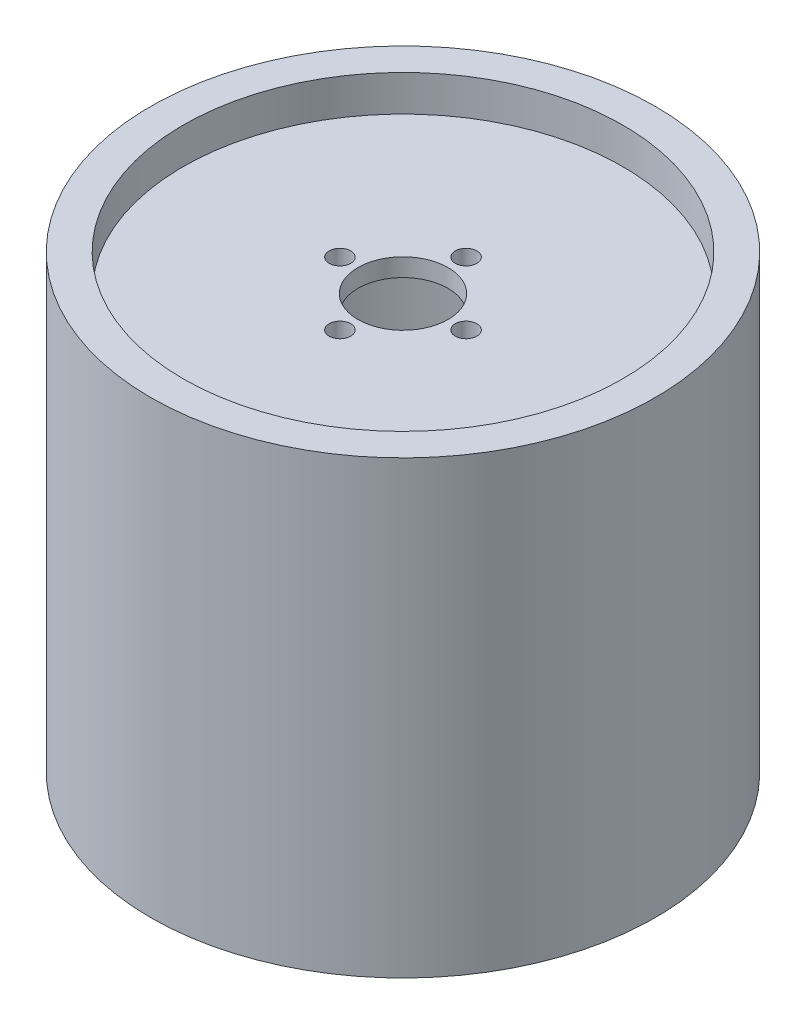
from build123d import *

# Parameters (mm, degrees)
SKETCH_1_R          = 70
EXTRUDE_1_DEPTH     = 125
SKETCH_4_R          = 60
CUT_EXTRUDE_4_DEPTH = 110
SKETCH_5_R          = 61
CUT_EXTRUDE_5_DEPTH = 10
SKETCH_6_R          = 12.5
SKETCH_6_R_2        = 3
CUT_EXTRUDE_6_DEPTH = 152.739909055
SKETCH_7_R          = 60
SKETCH_7_R_2        = 50
EXTRUDE_2_DEPTH     = 5
SKETCH_8_R          = 2.5
CUT_EXTRUDE_7_DEPTH = 5


with BuildPart() as part:
    # 스케치1 → 보스-돌출1 (new body)
    with BuildSketch(Plane(origin=(0, 0, 0), x_dir=(1, 0, 0), z_dir=(0, 1, 0))):
        Circle(SKETCH_1_R)
    extrude(amount=EXTRUDE_1_DEPTH)

    # 스케치4 → 컷-돌출4 (cut)
    with BuildSketch(Plane.XZ):
        Circle(SKETCH_4_R)
    extrude(amount=-CUT_EXTRUDE_4_DEPTH, mode=Mode.SUBTRACT)

    # 스케치5 → 컷-돌출5 (cut)
    with BuildSketch(Plane(origin=(0, 125, 0), x_dir=(1, 0, 0), z_dir=(0, 1, 0))):
        Circle(SKETCH_5_R)
    extrude(amount=-CUT_EXTRUDE_5_DEPTH, mode=Mode.SUBTRACT)

    # 스케치6 → 컷-돌출6 (cut, through all)
    with BuildSketch(Plane(origin=(0, 115, 0), x_dir=(1, 0, 0), z_dir=(0, 1, 0))):
        Circle(SKETCH_6_R)
        with Locations((0, -17.5)):
            Circle(SKETCH_6_R_2)
        with Locations((-17.5, 0)):
            Circle(SKETCH_6_R_2)
        with Locations((0, 17.5)):
            Circle(SKETCH_6_R_2)
        with Locations((17.5, 0)):
            Circle(SKETCH_6_R_2)
    extrude(amount=-CUT_EXTRUDE_6_DEPTH, mode=Mode.SUBTRACT)

    # 스케치7 → 보스-돌출2 (add)
    with BuildSketch(Plane.XZ):
        Circle(SKETCH_7_R)
        Circle(SKETCH_7_R_2, mode=Mode.SUBTRACT)
    extrude(amount=-EXTRUDE_2_DEPTH)

    # 스케치8 → 컷-돌출7 (cut)
    with BuildSketch(Plane.XZ):
        with Locations((0, -55)):
            Circle(SKETCH_8_R)
        with Locations((-55, 0)):
            Circle(SKETCH_8_R)
        with Locations((0, 55)):
            Circle(SKETCH_8_R)
        with Locations((55, 0)):
            Circle(SKETCH_8_R)
    extrude(amount=-CUT_EXTRUDE_7_DEPTH, mode=Mode.SUBTRACT)


solid = part.part
